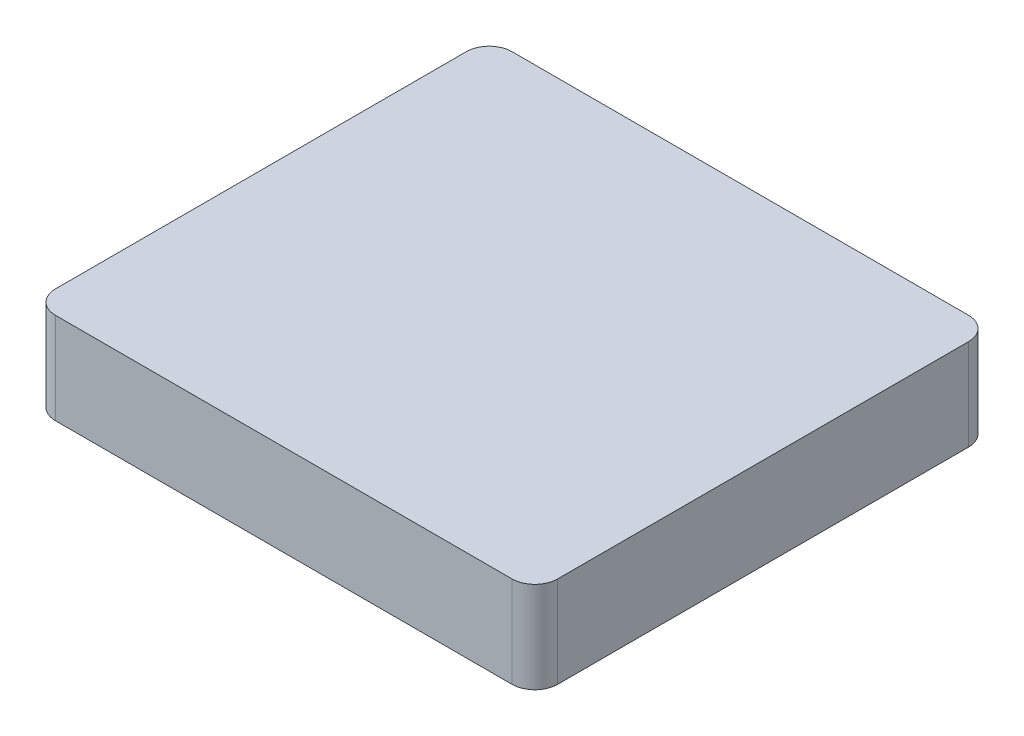
from build123d import *

# Parameters (mm, degrees)
SKETCH1_W           = 13.97
SKETCH1_H           = 12.7
BOSS_EXTRUDE1_DEPTH = 2.54
FILLET1_R           = 0.635
SHELL1_START        = 0.635
SHELL1_OUTLINE_W    = 1.905
SHELL1_OUTLINE_H    = 11.43
SHELL1_DEPTH        = 12.7
SKETCH2_R           = 2.54
BOSS_EXTRUDE2_DEPTH = 1.905


# Read off the part's stored shape, not the designer's step: Shell1
with BuildPart() as part:
    # Sketch1 → Boss-Extrude1 (new body)
    with BuildSketch(Plane(origin=(0, 0, 0), x_dir=(1, 0, 0), z_dir=(0, 1, 0))):
        with Locations((6.985, 6.35)):
            Rectangle(SKETCH1_W, SKETCH1_H)
    extrude(amount=BOSS_EXTRUDE1_DEPTH)

    # Fillet1
    fillet1_edges = [part.edges().sort_by_distance(p)[0] for p in [
        (0, 1.27, -12.7),
        (13.97, 1.27, -12.7),
        (13.97, 1.27, 0),
        (0, 1.27, 0),
    ]]
    fillet(fillet1_edges, radius=FILLET1_R)

    # Shell1 outline → Shell1 (cut)
    with BuildSketch(Plane.YZ.offset(SHELL1_START)):
        with Locations((0.9525, -6.35)):
            Rectangle(SHELL1_OUTLINE_W, SHELL1_OUTLINE_H)
    extrude(amount=SHELL1_DEPTH, mode=Mode.SUBTRACT)

    # Sketch2 → Boss-Extrude2 (add)
    with BuildSketch(Plane(origin=(0, 1.905, 0), x_dir=(-1, 0, 0), z_dir=(0, -1, 0))):
        with Locations(Location((-6.985, 6.35, 0), (0, 0, 270))):
            Circle(SKETCH2_R)
    extrude(amount=BOSS_EXTRUDE2_DEPTH)


solid = part.part
